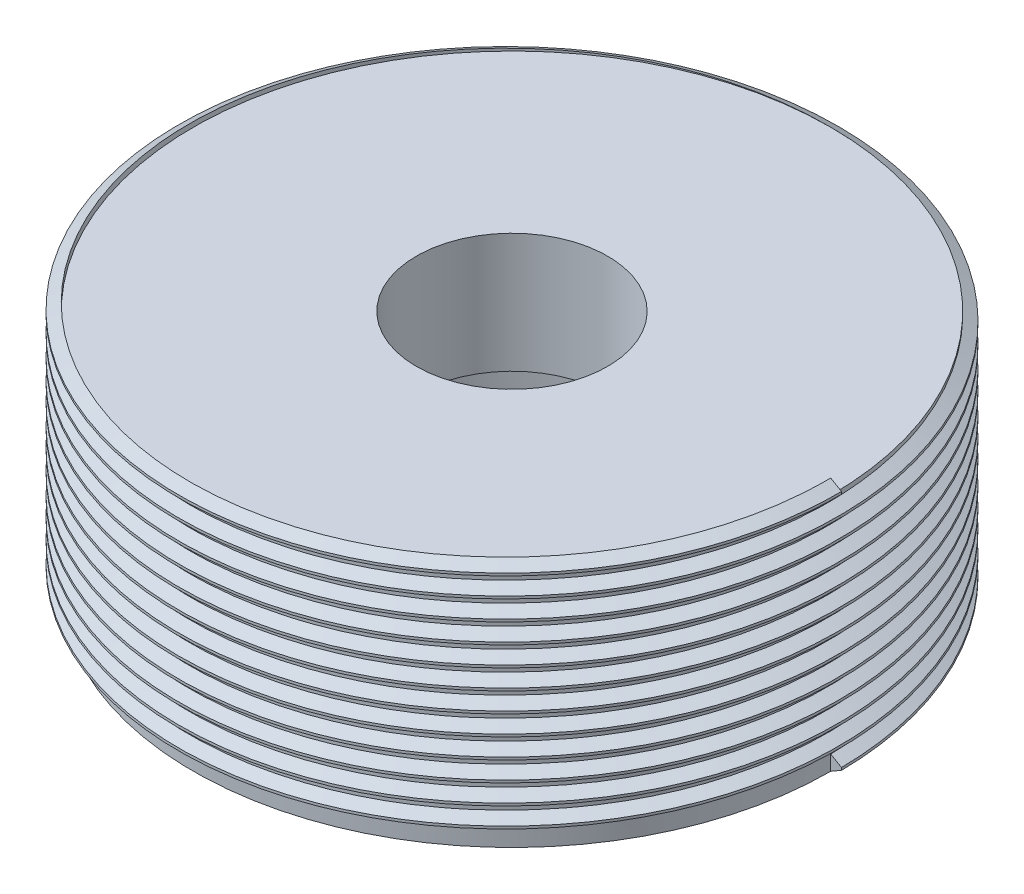
from build123d import *
from build123d.topology import SkipClean

# Parameters (mm, degrees)
SKETCH2_R           = 40
BOSS_EXTRUDE1_DEPTH = 30
SKETCH4_R           = 12
CUT_EXTRUDE1_DEPTH  = 15
SKETCH5_R           = 25
CUT_EXTRUDE2_DEPTH  = 15
THREAD1_PITCH       = 2.5


with BuildPart() as part:
    # Sketch2 → Boss-Extrude1 (new body)
    with BuildSketch(Plane(origin=(0, 0, 0), x_dir=(1, 0, 0), z_dir=(0, 1, 0))):
        with Locations(Location((0, 0, 0), (0, 0, 270))):
            Circle(SKETCH2_R)
    extrude(amount=BOSS_EXTRUDE1_DEPTH)

    # Sketch4 → Cut-Extrude1 (cut)
    with BuildSketch(Plane(origin=(0, 30, 0), x_dir=(1, 0, 0), z_dir=(0, 1, 0))):
        with Locations(Location((0, 0, 0), (0, 0, 270))):
            Circle(SKETCH4_R)
    extrude(amount=-CUT_EXTRUDE1_DEPTH, mode=Mode.SUBTRACT)

    # Sketch5 → Cut-Extrude2 (cut)
    with BuildSketch(Plane(origin=(0, 15, 0), x_dir=(1, 0, 0), z_dir=(0, 1, 0))):
        with Locations(Location((0, 0, 0), (0, 0, 270))):
            Circle(SKETCH5_R)
    extrude(amount=-CUT_EXTRUDE2_DEPTH, mode=Mode.SUBTRACT)

    # Thread1: the profile of Thread Profile1 profile screwed along a right-hand helix of 12 turns, 10 arcs to a turn; built about Z, then put on its axis
    with SkipClean():  # the faces are left unmerged after this step: merging them gives an invalid solid
        thread1_z = Axis((0, 0, 0), (0, 0, 1))
        thread1_corners = [(39.9997, 0, -0.000173205), (41.353164687, 0, 0.781249997), (41.353164687, 0, 1.093749997), (39.9997, 0, 1.875173198)]
        with BuildLine(mode=Mode.PRIVATE) as thread1_profile:
            Line(thread1_corners[0], thread1_corners[1])
            Line(thread1_corners[1], thread1_corners[2])
            Line(thread1_corners[2], thread1_corners[3])
            Line(thread1_corners[3], thread1_corners[0])
        thread1_cap = Face(thread1_profile.wire())
        thread1_turn_angles = [0, 18, 36, 54, 72, 90, 108, 126, 144, 162, 180, 198, 216, 234, 252, 270, 288, 306, 324, 342, 360]
        thread1_turn_weights = [1, 0.9510565162951535, 1, 0.9510565162951535, 1, 0.9510565162951535, 1, 0.9510565162951535, 1, 0.9510565162951535, 1, 0.9510565162951535, 1, 0.9510565162951535, 1, 0.9510565162951535, 1, 0.9510565162951535, 1, 0.9510565162951535, 1]
        thread1_turn_rails = [Edge.make_bspline([Vector(p[0], p[1], 0).rotate(thread1_z, thread1_turn_angles[k]) / thread1_turn_weights[k] + Vector(0, 0, p[2] + THREAD1_PITCH * thread1_turn_angles[k] / 360) for k in range(21)], [0, 0, 0, 1, 1, 2, 2, 3, 3, 4, 4, 5, 5, 6, 6, 7, 7, 8, 8, 9, 9, 10, 10, 10], 2, thread1_turn_weights) for p in thread1_corners]
        thread1_turn_sides = [Face.make_surface_from_curves(thread1_turn_rails[p[0]], thread1_turn_rails[p[1]]) for p in [(0, 1), (1, 2), (2, 3), (3, 0)]]
        thread1 = Plane(origin=(0, 0, 0), x_dir=(1, 0, 0), z_dir=(0, 1, 0)) * Solid(Shell([*[p.moved(Location((0, 0, THREAD1_PITCH * i))) for i in range(12) for p in thread1_turn_sides], thread1_cap, thread1_cap.rotate(thread1_z, 4320).moved(Location((0, 0, THREAD1_PITCH * 4320 / 360)))]))
        add(thread1)


solid = part.part
